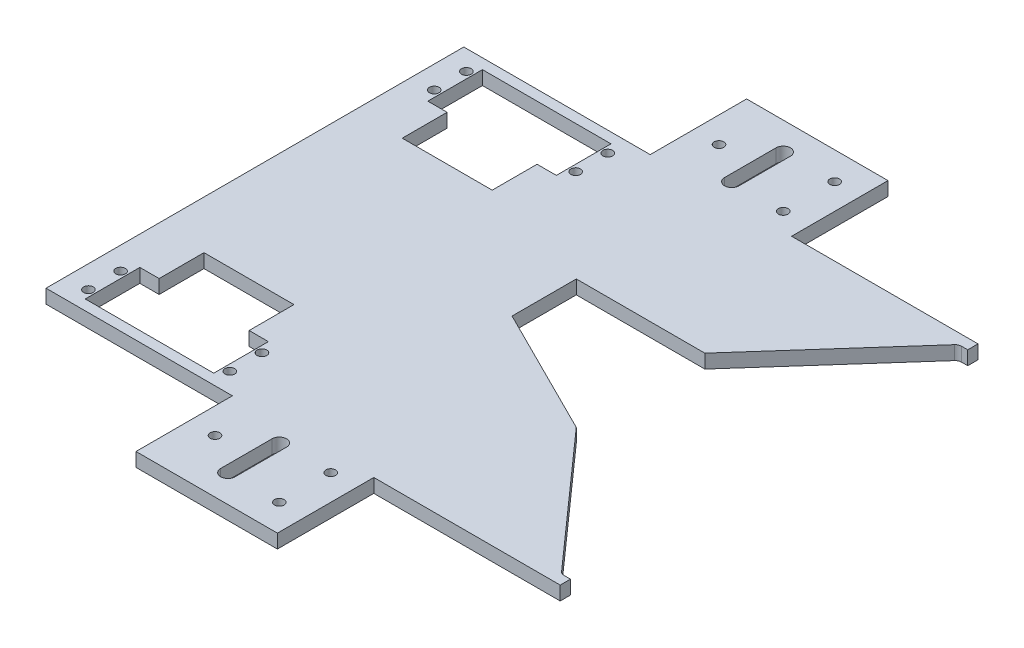
from build123d import *

# Parameters (mm, degrees)
BOSS_EXTRUDE1_DEPTH = 4.3
CUT_EXTRUDE1_DEPTH  = 4.5
FILLET1_R           = 2
CUT_EXTRUDE2_DEPTH  = 10
SKETCH8_R           = 1.5
CUT_EXTRUDE3_DEPTH  = 10
SKETCH9_R           = 1.5
CUT_EXTRUDE4_DEPTH  = 10


with BuildPart() as part:
    # Sketch2 → Boss-Extrude1 (new body)
    with BuildSketch(Plane(origin=(0, 0, 0), x_dir=(1, 0, 0), z_dir=(0, 1, 0))):
        Polygon((0, 0), (0, 65), (58, 65), (58, 95), (102, 95), (102, 65), (160, 65), (160, 0), align=None)
    extrude(amount=BOSS_EXTRUDE1_DEPTH)

    # Mirror1: part across plane


with BuildPart() as part_1:
    add(part.part)
    add(part.part.mirror(Plane(origin=(0, 4.3, 0), x_dir=(1, 0, 0), z_dir=(0, 0, -1))))

    # Sketch3 → Cut-Extrude1 (cut)
    with BuildSketch(Plane(origin=(0, 4.3, 0), x_dir=(1, 0, 0), z_dir=(0, 1, 0))):
        Polygon((160, -61.8), (160, 61.8), (157.156451185, 61.8), (120.012594795, 20), (80.012594795, 20), (80.012594795, 0), (120, -20), (157.155555556, -61.8), align=None)
    extrude(amount=-CUT_EXTRUDE1_DEPTH, mode=Mode.SUBTRACT)

    # Fillet1
    fillet1_edges = [part_1.edges().sort_by_distance(p)[0] for p in [
        (157.156451185, 2.15, -61.8),
        (157.155555556, 2.15, 61.8),
    ]]
    fillet(fillet1_edges, radius=FILLET1_R)

    # Sketch6 → Cut-Extrude2 (cut)
    with BuildSketch(Plane(origin=(0, 4.3, 0), x_dir=(1, 0, 0), z_dir=(0, 1, 0))):
        Polygon((9, -61.8), (49, -61.8), (49, -44.8), (43, -44.8), (43, -30.841820122), (15, -30.841820122), (15, -44.8), (9, -44.8), align=None)
        Polygon((9, 44.8), (15, 44.8), (15, 30.841820122), (43, 30.841820122), (43, 44.8), (49, 44.8), (49, 61.8), (9, 61.8), align=None)
    extrude(amount=-CUT_EXTRUDE2_DEPTH, mode=Mode.SUBTRACT)

    # Sketch8 → Cut-Extrude3 (cut)
    with BuildSketch(Plane(origin=(0, 4.3, 0), x_dir=(1, 0, 0), z_dir=(0, 1, 0))):
        with Locations((7, 58.8)):
            Circle(SKETCH8_R)
        with Locations((7, 48.8)):
            Circle(SKETCH8_R)
        with Locations((51, 48.8)):
            Circle(SKETCH8_R)
        with Locations((51, 58.8)):
            Circle(SKETCH8_R)
        with Locations((7, -48.8)):
            Circle(SKETCH8_R)
        with Locations((7, -58.8)):
            Circle(SKETCH8_R)
        with Locations((51, -58.8)):
            Circle(SKETCH8_R)
        with Locations((51, -48.8)):
            Circle(SKETCH8_R)
    extrude(amount=-CUT_EXTRUDE3_DEPTH, mode=Mode.SUBTRACT)

    # Sketch9 → Cut-Extrude4 (cut)
    with BuildSketch(Plane.XZ):
        with Locations((94, 70.4)):
            Circle(SKETCH9_R)
        with Locations((66, 78.4)):
            Circle(SKETCH9_R)
        with Locations((66, -78.4)):
            Circle(SKETCH9_R)
        with Locations((94, -86.4)):
            Circle(SKETCH9_R)
        with Locations((94, 86.4)):
            Circle(SKETCH9_R)
        with Locations((94, -70.4)):
            Circle(SKETCH9_R)
        with BuildLine():
            Line((75.75, 70.4), (75.75, 86.4))
            ThreePointArc((75.75, 86.4), (78, 88.65), (80.25, 86.4))
            Line((80.25, 86.4), (80.25, 70.4))
            ThreePointArc((80.25, 70.4), (78, 68.15), (75.75, 70.4))
        make_face()
        with BuildLine():
            Line((75.75, -86.4), (75.75, -70.4))
            ThreePointArc((75.75, -70.4), (78, -68.15), (80.25, -70.4))
            Line((80.25, -70.4), (80.25, -86.4))
            ThreePointArc((80.25, -86.4), (78, -88.65), (75.75, -86.4))
        make_face()
    extrude(amount=-CUT_EXTRUDE4_DEPTH, mode=Mode.SUBTRACT)


solid = part_1.part
